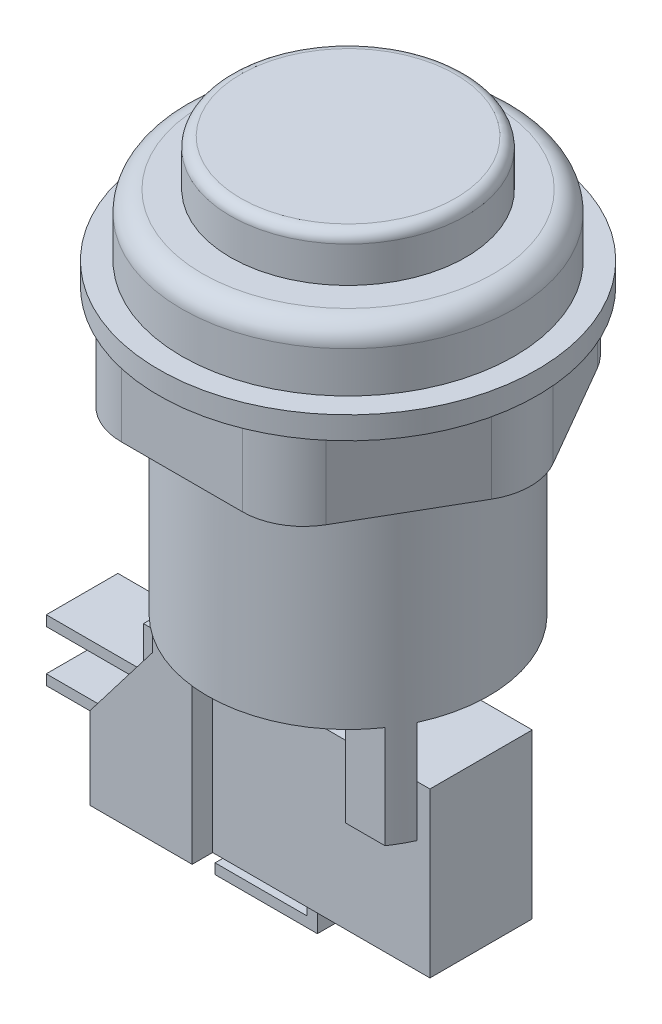
from build123d import *

# Parameters (mm, degrees)
CROQUIS1_R               = 11.5
SALIENTE_EXTRUIR1_DEPTH  = 4.5
REDONDEO1_R              = 1
CROQUIS2_R               = 16.25
SALIENTE_EXTRUIR2_DEPTH  = 6
REDONDEO2_R              = 2
CROQUIS3_R               = 13.75
SALIENTE_EXTRUIR3_DEPTH  = 30
CROQUIS5_R               = 18.5
SALIENTE_EXTRUIR4_DEPTH  = 2.2
SALIENTE_EXTRUIR5_DEPTH  = 8
REDONDEO3_R              = 6
CROQUIS7_W               = 10
CROQUIS7_H               = 2
SALIENTE_EXTRUIR6_DEPTH  = 10
CROQUIS8_W               = 10
CROQUIS8_H               = 2
SALIENTE_EXTRUIR7_DEPTH  = 11
SALIENTE_EXTRUIR8_DEPTH  = 2
CORTAR_EXTRUIR1_DEPTH    = 66.424097243
CROQUIS12_W              = 28
CROQUIS12_H              = 10
SALIENTE_EXTRUIR9_DEPTH  = 16
CROQUIS13_W              = 1
CROQUIS13_H              = 7
SALIENTE_EXTRUIR10_DEPTH = 4
CROQUIS14_W              = 7
CROQUIS14_H              = 1
SALIENTE_EXTRUIR11_DEPTH = 9
CROQUIS15_W              = 7
CROQUIS15_H              = 1
SALIENTE_EXTRUIR12_DEPTH = 11


with BuildPart() as part:
    # Croquis1 → Saliente-Extruir1 (new body)
    with BuildSketch(Plane(origin=(0, 0, 0), x_dir=(1, 0, 0), z_dir=(0, 1, 0))):
        with Locations(Location((0, 0, 0), (0, 0, 270))):
            Circle(CROQUIS1_R)
    extrude(amount=SALIENTE_EXTRUIR1_DEPTH)

    # Redondeo1
    redondeo1_edges = [part.edges().sort_by_distance(p)[0] for p in [
        (0, 4.5, -11.5),
    ]]
    fillet(redondeo1_edges, radius=REDONDEO1_R)

    # Croquis2 → Saliente-Extruir2 (add)
    with BuildSketch(Plane.XZ):
        with Locations(Location((0, 0, 0), (0, 0, 270))):
            Circle(CROQUIS2_R)
    extrude(amount=SALIENTE_EXTRUIR2_DEPTH)

    # Redondeo2
    redondeo2_edges = [part.edges().sort_by_distance(p)[0] for p in [
        (0, 0, 16.25),
    ]]
    fillet(redondeo2_edges, radius=REDONDEO2_R)

    # Croquis3 → Saliente-Extruir3 (add)
    with BuildSketch(Plane.XZ.offset(6)):
        with Locations(Location((0, 0, 0), (0, 0, 270))):
            Circle(CROQUIS3_R)
    extrude(amount=SALIENTE_EXTRUIR3_DEPTH)

    # Croquis5 → Saliente-Extruir4 (add)
    with BuildSketch(Plane.XZ.offset(6)):
        with Locations(Location((0, 0, 0), (0, 0, 270))):
            Circle(CROQUIS5_R)
    extrude(amount=SALIENTE_EXTRUIR4_DEPTH)

    # Croquis6 → Saliente-Extruir5 (add)
    with BuildSketch(Plane.XZ.offset(8.2)):
        Polygon((18.763883749, 0), (9.381941874, 16.25), (-9.381941874, 16.25), (-18.763883749, 0), (-9.381941874, -16.25), (9.381941874, -16.25), align=None)
    extrude(amount=SALIENTE_EXTRUIR5_DEPTH)

    # Redondeo3
    # the kernel refuses this fillet: 6 mm, written as the material it takes off along each edge
    with BuildSketch(Plane(origin=(9.381941874, -8.2, -16.25), x_dir=(-1, 0, 0), z_dir=(0, -1, 0))) as redondeo3_piece_1:
        with BuildLine():
            CenterArc((REDONDEO3_R * 0.57735026919, -REDONDEO3_R), REDONDEO3_R, 90, 60)
            Line((-REDONDEO3_R * 0.288675134595, -REDONDEO3_R * 0.5), (0, 0))
            Line((0, 0), (REDONDEO3_R * 0.57735026919, 0))
        make_face()
    extrude(amount=16.660254038, mode=Mode.SUBTRACT)
    with BuildSketch(Plane(origin=(18.763883749, -8.2, 0), x_dir=(-0.4999999999999997, 0, 0.8660254037844387), z_dir=(0, -1, 0)), Plane(origin=(9.381941874, -8.2, 16.25), x_dir=(-1, 0, 0), z_dir=(0, -1, 0)), Plane(origin=(-9.381941874, -8.2, 16.25), x_dir=(-0.5, 0, -0.8660254037844386), z_dir=(0, -1, 0)), Plane(origin=(-18.763883749, -8.2, 0), x_dir=(0.4999999999999992, 0, -0.866025403784439), z_dir=(0, -1, 0)), Plane(origin=(-9.381941874, -8.2, -16.25), x_dir=(1, 0, 0), z_dir=(0, -1, 0))) as redondeo3_piece_2:
        with BuildLine():
            CenterArc((REDONDEO3_R * 0.57735026919, REDONDEO3_R), REDONDEO3_R, 210, 60)
            Line((-REDONDEO3_R * 0.288675134595, REDONDEO3_R * 0.5), (0, 0))
            Line((0, 0), (REDONDEO3_R * 0.57735026919, 0))
        make_face()
    extrude(amount=16.660254038, mode=Mode.SUBTRACT)

    # Croquis7 → Saliente-Extruir6 (add)
    with BuildSketch(Plane.XZ.offset(36)):
        with BuildLine():
            Line((-7.489995997, 5.75), (-12.489995997, 5.75))
            ThreePointArc((-12.489995997, 5.75), (-11.965765437, 6.773696), (-11.357816692, 7.75))
            Line((-11.357816692, 7.75), (-7.489995997, 7.75))
            Line((-7.489995997, 7.75), (-7.489995997, 5.75))
        make_face()
        with BuildLine():
            Line((7.489995997, 7.75), (11.357816692, 7.75))
            ThreePointArc((11.357816692, 7.75), (11.965765437, 6.773696), (12.489995997, 5.75))
            Line((12.489995997, 5.75), (7.489995997, 5.75))
            Line((7.489995997, 5.75), (7.489995997, 7.75))
        make_face()
        with Locations((0, -5.25)):
            Rectangle(CROQUIS7_W, CROQUIS7_H)
    extrude(amount=SALIENTE_EXTRUIR6_DEPTH)

    # Croquis8 → Saliente-Extruir7 (add)
    with BuildSketch(Plane.XZ.offset(46)):
        with Locations((-12.489995997, 6.75)):
            Rectangle(CROQUIS8_W, CROQUIS8_H)
    extrude(amount=SALIENTE_EXTRUIR7_DEPTH)

    # Croquis9 → Saliente-Extruir8 (add)
    with BuildSketch(Plane.XY.offset(7.75)):
        Polygon((-17.489995997, -49), (-11.357816692, -41), (-11.357816692, -49), align=None)
    extrude(amount=-SALIENTE_EXTRUIR8_DEPTH)

    # Croquis11 → Cortar-Extruir1 (cut, through all)
    with BuildSketch(Plane.XY.offset(7.75)):
        Polygon((-15.190428757, -46), (-17.489995997, -49), (-17.489995997, -46), align=None)
    extrude(amount=-CORTAR_EXTRUIR1_DEPTH, mode=Mode.SUBTRACT)

    # Croquis12 → Saliente-Extruir9 (add)
    with BuildSketch(Plane(origin=(0, -41, 0), x_dir=(-1, 0, 0), z_dir=(0, -1, 0))):
        with Locations((0.25, -0.75)):
            Rectangle(CROQUIS12_W, CROQUIS12_H)
    extrude(amount=SALIENTE_EXTRUIR9_DEPTH)

    # Croquis13 → Saliente-Extruir10 (add)
    with BuildSketch(Plane.XZ.offset(57)):
        Rectangle(CROQUIS13_W, CROQUIS13_H)
    extrude(amount=SALIENTE_EXTRUIR10_DEPTH)

    # Croquis14 → Saliente-Extruir11 (add)
    with BuildSketch(Plane.ZY.offset(0.5)):
        with Locations((0, -60.5)):
            Rectangle(CROQUIS14_W, CROQUIS14_H)
    extrude(amount=SALIENTE_EXTRUIR11_DEPTH)

    # Croquis15 → Saliente-Extruir12 (add)
    with BuildSketch(Plane.ZY.offset(14.25)):
        with Locations((0.75, -47)):
            Rectangle(CROQUIS15_W, CROQUIS15_H)
        with Locations((0.75, -52)):
            Rectangle(CROQUIS15_W, CROQUIS15_H)
    extrude(amount=SALIENTE_EXTRUIR12_DEPTH)


solid = part.part
